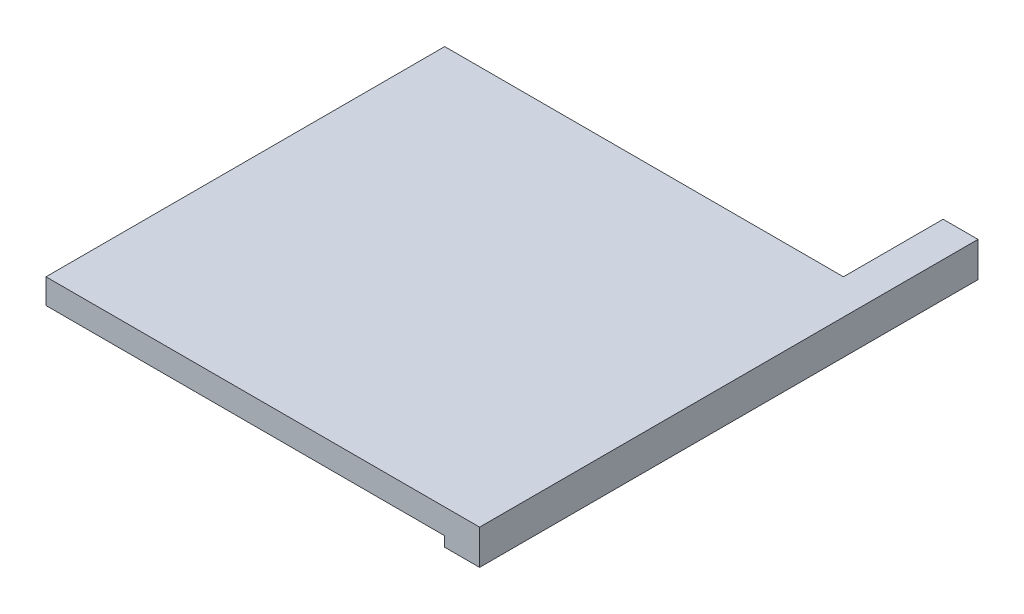
from build123d import *

# Parameters (mm, degrees)
SKETCH1_W           = 7
SKETCH1_H           = 7
BOSS_EXTRUDE1_DEPTH = 100
SKETCH3_W           = 80
SKETCH3_H           = 80
BOSS_EXTRUDE2_DEPTH = 5


with BuildPart() as part:
    # Sketch1 → Boss-Extrude1 (new body)
    with BuildSketch(Plane.XY):
        Rectangle(SKETCH1_W, SKETCH1_H)
    extrude(amount=BOSS_EXTRUDE1_DEPTH)

    # Sketch3 → Boss-Extrude2 (add)
    with BuildSketch(Plane(origin=(0, 3.5, 0), x_dir=(1, 0, 0), z_dir=(0, 1, 0))):
        with Locations((-43.5, -60)):
            Rectangle(SKETCH3_W, SKETCH3_H)
    extrude(amount=-BOSS_EXTRUDE2_DEPTH)


solid = part.part
